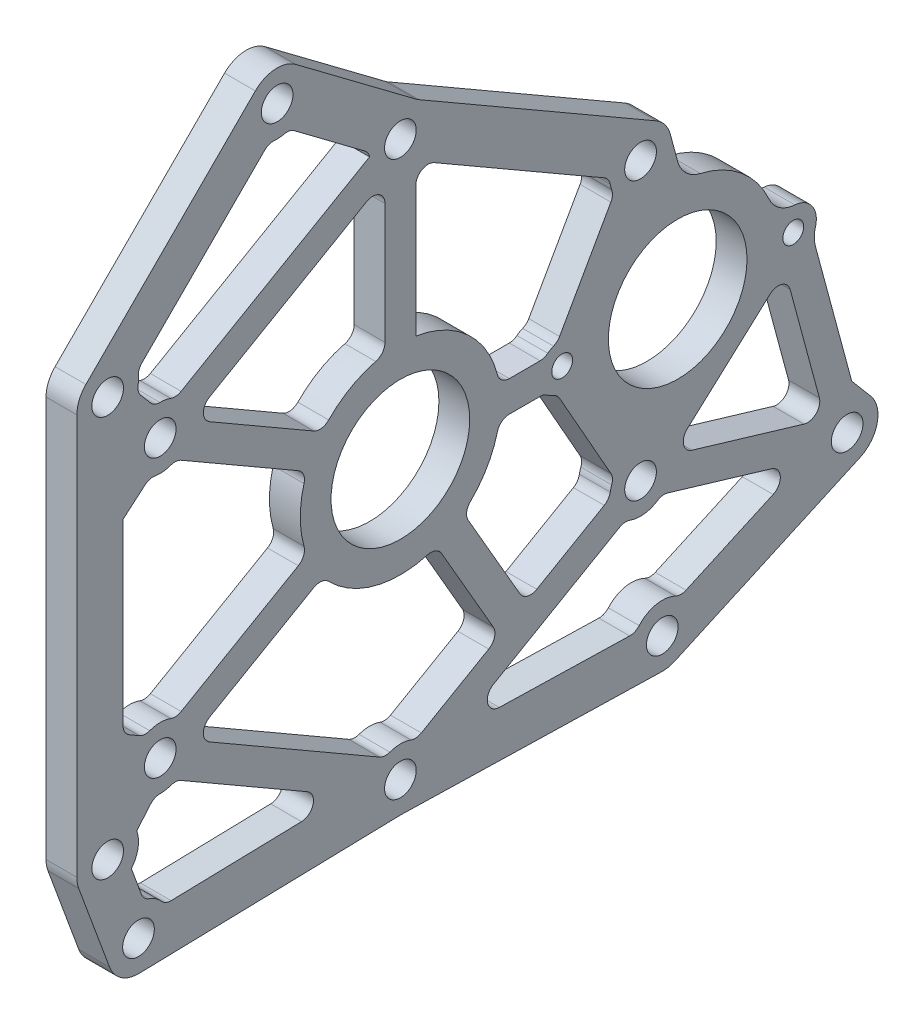
from build123d import *

# Parameters (mm, degrees)
SKETCH1_R           = 3.2639
SKETCH1_R_2         = 14.2875
SKETCH1_R_3         = 2.1463
BOSS_EXTRUDE1_DEPTH = 6.35
FILLET1_R           = 6.35
CUT_EXTRUDE1_DEPTH  = 129.616894934
FILLET2_R           = 2.54


with BuildPart() as part:
    # Sketch1 → Boss-Extrude1 (new body)
    with BuildSketch(Plane(origin=(0, 0, 0), x_dir=(0, 0, -1), z_dir=(1, 0, 0))):
        with BuildLine():
            Line((-66.675, 41.275), (-66.675, -41.275))
            ThreePointArc((-66.675, -41.275), (-66.576169332, -42.390966836), (-66.282753707, -43.472196115))
            Line((-66.282753707, -43.472196115), (-59.932753707, -60.690384235))
            ThreePointArc((-59.932753707, -60.690384235), (-57.541052248, -63.747307587), (-53.817026776, -64.841222814))
            Line((-53.817026776, -64.841222814), (-0.157973224, -63.505897139))
            ThreePointArc((-0.157973224, -63.505897139), (0, -63.503931831), (0.157973224, -63.505897139))
            Line((0.157973224, -63.505897139), (53.817026776, -64.841222814))
            ThreePointArc((53.817026776, -64.841222814), (55.235212183, -64.71688198), (56.59005615, -64.279722605))
            Line((56.59005615, -64.279722605), (94.69005615, -47.061534484))
            ThreePointArc((94.69005615, -47.061534484), (98.269102562, -42.673425347), (96.922502912, -37.173266767))
            Line((96.922502912, -37.173266767), (93.015657336, -32.556085631))
            Line((93.015657336, -32.556085631), (84.951172928, -2.602286403))
            ThreePointArc((84.951172928, -2.602286403), (83.92341694, 3.730198001), (77.522916667, 3.294035935))
            ThreePointArc((77.522916667, 3.294035935), (70.923774991, 15.368458893), (58.201383029, 20.610701103))
            Line((58.201383029, 20.610701103), (55.626980823, 30.218500936))
            ThreePointArc((55.626980823, 30.218500936), (54.531145537, 32.440635074), (52.668351826, 34.074261314))
            Line((52.668351826, 34.074261314), (3.835165361, 62.268114665))
            ThreePointArc((3.835165361, 62.268114665), (3.511379677, 62.468225223), (3.200165361, 62.687375979))
            Line((3.200165361, 62.687375979), (-21.59, 81.28))
            ThreePointArc((-21.59, 81.28), (-25.850145278, 82.534024726), (-29.890128061, 80.690128061))
            Line((-29.890128061, 80.690128061), (-64.815128061, 45.765128061))
            ThreePointArc((-64.815128061, 45.765128061), (-66.191635031, 43.705039796), (-66.675, 41.275))
        make_face()
        with Locations((-53.975, -58.493188121)):
            Circle(SKETCH1_R, mode=Mode.SUBTRACT)
        with Locations((-60.325, -41.275)):
            Circle(SKETCH1_R, mode=Mode.SUBTRACT)
        with Locations((-49.493351826, -28.575)):
            Circle(SKETCH1_R, mode=Mode.SUBTRACT)
        with Locations((0, -57.15)):
            Circle(SKETCH1_R, mode=Mode.SUBTRACT)
        Circle(SKETCH1_R_2, mode=Mode.SUBTRACT)
        with Locations((53.975, -58.493188121)):
            Circle(SKETCH1_R, mode=Mode.SUBTRACT)
        with Locations((49.493351826, -28.575)):
            Circle(SKETCH1_R, mode=Mode.SUBTRACT)
        with Locations((92.075, -41.275)):
            Circle(SKETCH1_R, mode=Mode.SUBTRACT)
        with Locations((33.3375, 0)):
            Circle(SKETCH1_R_3, mode=Mode.SUBTRACT)
        with Locations((57.15, 0)):
            Circle(SKETCH1_R_2, mode=Mode.SUBTRACT)
        with Locations((80.9625, 0)):
            Circle(SKETCH1_R_3, mode=Mode.SUBTRACT)
        with Locations((-49.493351826, 28.575)):
            Circle(SKETCH1_R, mode=Mode.SUBTRACT)
        with Locations((-60.325, 41.275)):
            Circle(SKETCH1_R, mode=Mode.SUBTRACT)
        with Locations((-25.4, 76.2)):
            Circle(SKETCH1_R, mode=Mode.SUBTRACT)
        with Locations((0, 57.15)):
            Circle(SKETCH1_R, mode=Mode.SUBTRACT)
        with Locations((49.493351826, 28.575)):
            Circle(SKETCH1_R, mode=Mode.SUBTRACT)
    extrude(amount=BOSS_EXTRUDE1_DEPTH)

    # Fillet1
    fillet1_edges = [part.edges().sort_by_distance(p)[0] for p in [
        (3.175, -2.602286403, -84.951172928),
        (3.175, 20.610701103, -58.201383029),
        (3.175, 3.294035935, -77.522916667),
    ]]
    fillet(fillet1_edges, radius=FILLET1_R)

    # Sketch2 → Cut-Extrude1 (cut, through all)
    with BuildSketch(Plane(origin=(6.35, 0, 0), x_dir=(0, 0, -1), z_dir=(1, 0, 0))):
        with BuildLine():
            Line((-27.043500936, 70.066371003), (-54.191371003, 42.918500936))
            ThreePointArc((-54.191371003, 42.918500936), (-53.979982179, 41.023506749), (-54.34069346, 39.151188513))
            Line((-54.34069346, 39.151188513), (-50.646230396, 34.819467231))
            ThreePointArc((-50.646230396, 34.819467231), (-48.415819119, 34.832908857), (-46.318351826, 34.074261314))
            Line((-46.318351826, 34.074261314), (-6.35, 57.15))
            ThreePointArc((-6.35, 57.15), (-6.338592015, 57.530461907), (-6.304409051, 57.909556788))
            Line((-6.304409051, 57.909556788), (-22.905590949, 70.360443212))
            ThreePointArc((-22.905590949, 70.360443212), (-24.949854722, 69.865975274), (-27.043500936, 70.066371003))
        make_face()
        with BuildLine():
            Line((-51.617163313, 22.59069346), (-57.15, 17.871816263))
            Line((-57.15, 17.871816263), (-57.15, -20.488257906))
            Line((-57.15, -20.488257906), (-52.668351826, -23.075738686))
            ThreePointArc((-52.668351826, -23.075738686), (-49.493351826, -22.225), (-46.318351826, -23.075738686))
            Line((-46.318351826, -23.075738686), (-19.247322647, -7.446272702))
            ThreePointArc((-19.247322647, -7.446272702), (-20.6375, 0), (-19.247322647, 7.446272702))
            Line((-19.247322647, 7.446272702), (-46.318351826, 23.075738686))
            ThreePointArc((-46.318351826, 23.075738686), (-48.914502502, 22.25143823), (-51.617163313, 22.59069346))
        make_face()
        with BuildLine():
            Line((-3.175, 51.650738686), (-43.143351826, 28.575))
            Line((-43.143351826, 28.575), (-16.072322647, 12.945534016))
            ThreePointArc((-16.072322647, 12.945534016), (-10.31875, 17.872599271), (-3.175, 20.391806719))
            Line((-3.175, 20.391806719), (-3.175, 51.650738686))
        make_face()
        with BuildLine():
            ThreePointArc((-54.34069346, -39.151188513), (-54.073566297, -42.389484927), (-55.443295494, -45.335968002))
            Line((-55.443295494, -45.335968002), (-52.898950799, -52.235024004))
            ThreePointArc((-52.898950799, -52.235024004), (-50.408947752, -53.239068655), (-48.556427304, -55.182361949))
            Line((-48.556427304, -55.182361949), (-11.361262376, -54.256746318))
            Line((-11.361262376, -54.256746318), (-46.318351826, -34.074261314))
            ThreePointArc((-46.318351826, -34.074261314), (-48.415819119, -34.832908857), (-50.646230396, -34.819467231))
            Line((-50.646230396, -34.819467231), (-54.34069346, -39.151188513))
        make_face()
        with BuildLine():
            Line((43.143351826, 28.575), (3.175, 51.650738686))
            Line((3.175, 51.650738686), (3.175, 20.391806719))
            ThreePointArc((3.175, 20.391806719), (14.592916197, 14.592916197), (20.391806719, 3.175))
            Line((20.391806719, 3.175), (29.787742086, 3.175))
            ThreePointArc((29.787742086, 3.175), (30.937670776, 4.113663324), (32.320735068, 4.652697639))
            Line((32.320735068, 4.652697639), (44.022955866, 25.350520502))
            ThreePointArc((44.022955866, 25.350520502), (43.367198288, 26.90384985), (43.143351826, 28.575))
        make_face()
        with BuildLine():
            Line((-16.072322647, -12.945534016), (-43.143351826, -28.575))
            Line((-43.143351826, -28.575), (-3.175, -51.650738686))
            ThreePointArc((-3.175, -51.650738686), (0, -50.8), (3.175, -51.650738686))
            Line((3.175, -51.650738686), (20.409545256, -41.700369343))
            Line((20.409545256, -41.700369343), (7.446272702, -19.247322647))
            ThreePointArc((7.446272702, -19.247322647), (-5.341378043, -19.93429424), (-16.072322647, -12.945534016))
        make_face()
        with BuildLine():
            ThreePointArc((32.320735068, -4.652697639), (30.937670776, -4.113663324), (29.787742086, -3.175))
            Line((29.787742086, -3.175), (20.391806719, -3.175))
            ThreePointArc((20.391806719, -3.175), (17.872599271, -10.31875), (12.945534016, -16.072322647))
            Line((12.945534016, -16.072322647), (25.90880657, -38.525369343))
            Line((25.90880657, -38.525369343), (43.143351826, -28.575))
            ThreePointArc((43.143351826, -28.575), (43.367198288, -26.90384985), (44.022955866, -25.350520502))
            Line((44.022955866, -25.350520502), (32.320735068, -4.652697639))
        make_face()
        with BuildLine():
            Line((11.361262376, -54.256746318), (48.556427304, -55.182361949))
            ThreePointArc((48.556427304, -55.182361949), (52.714787817, -52.269494262), (57.678757788, -53.335215821))
            Line((57.678757788, -53.335215821), (83.013909173, -41.885730188))
            Line((83.013909173, -41.885730188), (53.855774459, -33.189300464))
            ThreePointArc((53.855774459, -33.189300464), (50.23381253, -34.881680422), (46.318351826, -34.074261314))
            Line((46.318351826, -34.074261314), (11.361262376, -54.256746318))
        make_face()
        Polygon((55.795218544, -27.141329703), (87.52996775, -36.606236117), (79.248174638, -5.845290271), align=None)
    extrude(amount=-CUT_EXTRUDE1_DEPTH, mode=Mode.SUBTRACT)

    # Fillet2
    # the kernel refuses this fillet: 2.54 mm, written as the material it adds along each edge
    with BuildSketch(Plane(origin=(6.35, -36.606236117, -87.52996775), x_dir=(0, 0.2858094655797608, 0.9582864651997396), z_dir=(-1, 0, 0))) as fillet2_piece_1:
        with BuildLine():
            CenterArc((FILLET2_R * 1.7920692281, FILLET2_R), FILLET2_R, 148.324271538, 121.675728462)
            Line((FILLET2_R * 0.941035595636, FILLET2_R * 1.52511118481), (FILLET2_R * 0.924014922987, FILLET2_R * 1.53561340851))
            Line((FILLET2_R * 0.924014922987, FILLET2_R * 1.53561340851), (-FILLET2_R * 0.0170206726493, FILLET2_R * 0.0105022236963))
            Line((-FILLET2_R * 0.0170206726493, FILLET2_R * 0.0105022236963), (0, -FILLET2_R * 0.02))
            Line((0, -FILLET2_R * 0.02), (FILLET2_R * 1.7920692281, -FILLET2_R * 0.02))
            Line((FILLET2_R * 1.7920692281, -FILLET2_R * 0.02), (FILLET2_R * 1.7920692281, 0))
        make_face()
    extrude(amount=6.35)
    with BuildSketch(Plane(origin=(6.35, -5.845290271, -79.248174638), x_dir=(0, -0.9656157585206735, -0.2599734734478587), z_dir=(-1, 0, 0))) as fillet2_piece_2:
        with BuildLine():
            CenterArc((FILLET2_R * 1.63736229297, FILLET2_R), FILLET2_R, 152.828028306, 117.171971694)
            Line((FILLET2_R * 0.747722420101, FILLET2_R * 1.45666278215), (FILLET2_R * 0.729929622644, FILLET2_R * 1.4657960378))
            Line((FILLET2_R * 0.729929622644, FILLET2_R * 1.4657960378), (-FILLET2_R * 0.0327472458594, -FILLET2_R * 0.02))
            Line((-FILLET2_R * 0.0327472458594, -FILLET2_R * 0.02), (FILLET2_R * 1.63736229297, -FILLET2_R * 0.02))
            Line((FILLET2_R * 1.63736229297, -FILLET2_R * 0.02), (FILLET2_R * 1.63736229297, 0))
        make_face()
    extrude(amount=6.35)
    with BuildSketch(Plane(origin=(6.35, -27.141329703, -55.795218544), x_dir=(0, -0.28580946557976333, -0.9582864651997387), z_dir=(-1, 0, 0))) as fillet2_piece_3:
        with BuildLine():
            CenterArc((FILLET2_R * 1.77298804398, -FILLET2_R), FILLET2_R, 90, 121.152299844)
            Line((FILLET2_R * 0.917192809978, -FILLET2_R * 1.51731471799), (FILLET2_R * 0.900076905298, -FILLET2_R * 1.52766101235))
            Line((FILLET2_R * 0.900076905298, -FILLET2_R * 1.52766101235), (-FILLET2_R * 0.0171159046801, -FILLET2_R * 0.0103462943599))
            Line((-FILLET2_R * 0.0171159046801, -FILLET2_R * 0.0103462943599), (0, FILLET2_R * 0.02))
            Line((0, FILLET2_R * 0.02), (FILLET2_R * 1.77298804398, FILLET2_R * 0.02))
            Line((FILLET2_R * 1.77298804398, FILLET2_R * 0.02), (FILLET2_R * 1.77298804398, 0))
        make_face()
    extrude(amount=6.35)
    with BuildSketch(Plane(origin=(6.35, -55.182361949, -48.556427304), x_dir=(0, 0.024877673142268453, 0.9996905027952534), z_dir=(-1, 0, 0)), Plane(origin=(6.35, -33.189300464, -53.855774459), x_dir=(0, -0.2858094655798386, -0.9582864651997162), z_dir=(-1, 0, 0)), Plane(origin=(6.35, 25.350520502, -44.022955866), x_dir=(0, -0.8705006519204841, 0.49216726324087445), z_dir=(-1, 0, 0)), Plane(origin=(6.35, -28.575, -43.143351826), x_dir=(0, -0.49999999999997297, 0.8660254037844543), z_dir=(-1, 0, 0)), Plane(origin=(6.35, 34.819467231, 50.646230396), x_dir=(0, 0.7608547985275604, 0.6489221644832185), z_dir=(-1, 0, 0)), Plane(origin=(6.35, 42.918500936, 54.191371003), x_dir=(0, 0.7071067811865367, -0.7071067811865585), z_dir=(-1, 0, 0)), Plane(origin=(6.35, 70.360443212, 22.905590949), x_dir=(0, -0.5999999999999892, -0.8000000000000081), z_dir=(-1, 0, 0)), Plane(origin=(6.35, -23.075738686, 52.668351826), x_dir=(0, 0.499999999999939, 0.8660254037844738), z_dir=(-1, 0, 0)), Plane(origin=(6.35, 23.075738686, 46.318351826), x_dir=(0, -0.4999999999999284, -0.86602540378448), z_dir=(-1, 0, 0)), Plane(origin=(6.35, -51.650738686, 3.175), x_dir=(0, 0.49999999999993194, 0.8660254037844779), z_dir=(-1, 0, 0)), Plane(origin=(6.35, -52.235024004, 52.898950799), x_dir=(0, 0.9382289302447354, 0.3460151361599944), z_dir=(-1, 0, 0)), Plane(origin=(6.35, -34.074261314, 46.318351826), x_dir=(0, -0.49999999999993366, -0.8660254037844769), z_dir=(-1, 0, 0))) as fillet2_piece_4:
        with BuildLine():
            CenterArc((1.310355048, 2.54), FILLET2_R, 220.005200885, 49.994799115)
            Line((-0.635249627, 0.907142857), (-0.67416172, 0.874485714))
            ThreePointArc((-0.67416172, 0.874485714), (-0.339422746, 0.438306877), (-0.043994091, -0.0254))
            Line((-0.043994091, -0.0254), (0, -0.0508))
            Line((0, -0.0508), (1.310355048, -0.0508))
            Line((1.310355048, -0.0508), (1.310355048, 0))
        make_face()
    extrude(amount=6.35)
    with BuildSketch(Plane(origin=(6.35, -53.335215821, -57.678757788), x_dir=(0, 0.5102156062885996, 0.8600465307758394), z_dir=(-1, 0, 0)), Plane(origin=(6.35, -25.350520502, -44.022955866), x_dir=(0, -0.9024780320156424, 0.43073588395810847), z_dir=(-1, 0, 0)), Plane(origin=(6.35, 34.074261314, 46.318351826), x_dir=(0, 0.42257712736441655, 0.906326967174892), z_dir=(-1, 0, 0)), Plane(origin=(6.35, 39.151188513, 54.34069346), x_dir=(0, 0.9679856947383638, -0.2510053680340065), z_dir=(-1, 0, 0)), Plane(origin=(6.35, -23.075738686, 46.318351826), x_dir=(0, 0.42257712736440284, 0.9063269671748984), z_dir=(-1, 0, 0)), Plane(origin=(6.35, 22.59069346, 51.617163313), x_dir=(0, -0.25100536803401813, -0.9679856947383609), z_dir=(-1, 0, 0)), Plane(origin=(6.35, -51.650738686, -3.175), x_dir=(0, 0.42257712736440417, 0.9063269671748977), z_dir=(-1, 0, 0)), Plane(origin=(6.35, -34.819467231, 50.646230396), x_dir=(0, -0.09511235327319795, -0.995466544015837), z_dir=(-1, 0, 0))) as fillet2_piece_5:
        with BuildLine():
            CenterArc((1.328942573, 2.530324483), FILLET2_R, 215.002600442, 49.994799115)
            Line((-0.751637495, 1.073345904), (-0.793249096, 1.044206332))
            Line((-0.793249096, 1.044206332), (-0.041611601, -0.029139572))
            Line((-0.041611601, -0.029139572), (0.004429809, -0.05060649))
            ThreePointArc((0.004429809, -0.05060649), (0.553726072, -0.026611208), (1.103022336, -0.05060649))
            Line((1.103022336, -0.05060649), (1.107452144, 0))
        make_face()
    extrude(amount=6.35)
    with BuildSketch(Plane(origin=(6.35, -41.885730188, -83.013909173), x_dir=(0, -0.4118198661241969, 0.9112652730492085), z_dir=(-1, 0, 0))) as fillet2_piece_6:
        with BuildLine():
            CenterArc((FILLET2_R * 2.67986400985, FILLET2_R), FILLET2_R, 130.926447625, 139.073552375)
            Line((FILLET2_R * 2.02477436535, FILLET2_R * 1.75555116152), (FILLET2_R * 2.01167257246, FILLET2_R * 1.77066218475))
            Line((FILLET2_R * 2.01167257246, FILLET2_R * 1.77066218475), (-FILLET2_R * 0.01310179289, FILLET2_R * 0.0151110232304))
            Line((-FILLET2_R * 0.01310179289, FILLET2_R * 0.0151110232304), (0, -FILLET2_R * 0.02))
            Line((0, -FILLET2_R * 0.02), (FILLET2_R * 2.67986400985, -FILLET2_R * 0.02))
            Line((FILLET2_R * 2.67986400985, -FILLET2_R * 0.02), (FILLET2_R * 2.67986400985, 0))
        make_face()
    extrude(amount=6.35)
    with BuildSketch(Plane(origin=(6.35, -34.074261314, -46.318351826), x_dir=(0, -0.49999999999992195, 0.8660254037844837), z_dir=(-1, 0, 0)), Plane(origin=(6.35, 28.575, -43.143351826), x_dir=(0, 0.5000000000000767, 0.8660254037843944), z_dir=(-1, 0, 0)), Plane(origin=(6.35, 70.066371003, 27.043500936), x_dir=(0, -0.7071067811865624, 0.7071067811865327), z_dir=(-1, 0, 0)), Plane(origin=(6.35, -55.182361949, 48.556427304), x_dir=(0, 0.02487767314217471, -0.9996905027952556), z_dir=(-1, 0, 0))) as fillet2_piece_7:
        with BuildLine():
            CenterArc((1.310355048, -2.54), FILLET2_R, 90, 49.994799115)
            Line((-0.635249627, -0.907142857), (-0.67416172, -0.874485714))
            ThreePointArc((-0.67416172, -0.874485714), (-0.339422746, -0.438306877), (-0.043994091, 0.0254))
            Line((-0.043994091, 0.0254), (0, 0.0508))
            Line((0, 0.0508), (1.310355048, 0.0508))
            Line((1.310355048, 0.0508), (1.310355048, 0))
        make_face()
    extrude(amount=6.35)
    with BuildSketch(Plane(origin=(6.35, -54.256746318, -11.361262376), x_dir=(0, 0.49999999999999184, -0.8660254037844434), z_dir=(-1, 0, 0)), Plane(origin=(6.35, -54.256746318, 11.361262376), x_dir=(0, -0.024877673142222004, 0.9996905027952544), z_dir=(-1, 0, 0))) as fillet2_piece_8:
        with BuildLine():
            CenterArc((FILLET2_R * 3.554572812, FILLET2_R), FILLET2_R, 121.425532744, 148.574467256)
            Line((FILLET2_R * 3.03318286368, FILLET2_R * 1.85331853477), (FILLET2_R * 3.02275506471, FILLET2_R * 1.87038490547))
            Line((FILLET2_R * 3.02275506471, FILLET2_R * 1.87038490547), (-FILLET2_R * 0.0104277989665, FILLET2_R * 0.0170663706954))
            Line((-FILLET2_R * 0.0104277989665, FILLET2_R * 0.0170663706954), (0, -FILLET2_R * 0.02))
            Line((0, -FILLET2_R * 0.02), (FILLET2_R * 3.554572812, -FILLET2_R * 0.02))
            Line((FILLET2_R * 3.554572812, -FILLET2_R * 0.02), (FILLET2_R * 3.554572812, 0))
        make_face()
    extrude(amount=6.35)
    with BuildSketch(Plane(origin=(6.35, 51.650738686, -3.175), x_dir=(0, -0.499999999999991, -0.8660254037844438), z_dir=(-1, 0, 0)), Plane(origin=(6.35, 51.650738686, 3.175), x_dir=(0, -1, 0), z_dir=(-1, 0, 0))) as fillet2_piece_9:
        with BuildLine():
            CenterArc((FILLET2_R * 1.73205080757, FILLET2_R), FILLET2_R, 150, 120)
            Line((FILLET2_R * 0.866025403784, FILLET2_R * 1.5), (FILLET2_R * 0.848704895709, FILLET2_R * 1.51))
            Line((FILLET2_R * 0.848704895709, FILLET2_R * 1.51), (-FILLET2_R * 0.0173205080757, FILLET2_R * 0.01))
            Line((-FILLET2_R * 0.0173205080757, FILLET2_R * 0.01), (0, -FILLET2_R * 0.02))
            Line((0, -FILLET2_R * 0.02), (FILLET2_R * 1.73205080757, -FILLET2_R * 0.02))
            Line((FILLET2_R * 1.73205080757, -FILLET2_R * 0.02), (FILLET2_R * 1.73205080757, 0))
        make_face()
    extrude(amount=6.35)
    with BuildSketch(Plane(origin=(6.35, 4.652697639, -32.320735068), x_dir=(0, -0.29524206044005546, 0.955422485472846), z_dir=(-1, 0, 0)), Plane(origin=(6.35, -3.175, -29.787742086), x_dir=(0, -0.6863874195831854, -0.7272360760014154), z_dir=(-1, 0, 0))) as fillet2_piece_10:
        with BuildLine():
            CenterArc((1.01898763, 2.530924649), FILLET2_R, 226.655182243, 38.499950409)
            Line((-0.724436416, 0.683745016), (-0.759304897, 0.646801423))
            Line((-0.759304897, 0.646801423), (-0.034868481, -0.036943593))
            Line((-0.034868481, -0.036943593), (0.004290474, -0.050618493))
            ThreePointArc((0.004290474, -0.050618493), (0.402231959, -0.033783716), (0.800173444, -0.050618493))
            Line((0.800173444, -0.050618493), (0.804463918, 0))
        make_face()
    extrude(amount=6.35)
    with BuildSketch(Plane(origin=(6.35, 3.175, -29.787742086), x_dir=(0, 0, 1), z_dir=(-1, 0, 0)), Plane(origin=(6.35, -4.652697639, -32.320735068), x_dir=(0, -0.8705006519204627, -0.4921672632409122), z_dir=(-1, 0, 0))) as fillet2_piece_11:
        with BuildLine():
            CenterArc((0.996150273, 2.54), FILLET2_R, 231.500049591, 38.499950409)
            Line((-0.585035183, 0.552173913), (-0.616658892, 0.512417391))
            ThreePointArc((-0.616658892, 0.512417391), (-0.315706309, 0.251518219), (-0.037864084, -0.033866667))
            Line((-0.037864084, -0.033866667), (0, -0.0508))
            Line((0, -0.0508), (0.996150273, -0.0508))
            Line((0.996150273, -0.0508), (0.996150273, 0))
        make_face()
    extrude(amount=6.35)
    with BuildSketch(Plane(origin=(6.35, 3.175, -20.391806719), x_dir=(0, 0.9797069356812805, 0.20043532667171082), z_dir=(-1, 0, 0))) as fillet2_piece_12:
        with BuildLine():
            CenterArc((2.073543246, 2.537154047), FILLET2_R, 191.562416899, 75.7250493)
            Line((-0.41491237, 2.028048318), (-0.464681483, 2.017866203))
            Line((-0.464681483, 2.017866203), (-0.049769112, -0.010182115))
            Line((-0.049769112, -0.010182115), (0.002404108, -0.050743081))
            ThreePointArc((0.002404108, -0.050743081), (0.97666892, -0.027676635), (1.950933732, -0.050743081))
            Line((1.950933732, -0.050743081), (1.953337841, 0))
        make_face()
    extrude(amount=6.35)
    with BuildSketch(Plane(origin=(6.35, -3.175, -20.391806719), x_dir=(0, 0, -1), z_dir=(-1, 0, 0)), Plane(origin=(6.35, 12.945534016, 16.072322647), x_dir=(0, 0.5000000000000324, 0.86602540378442), z_dir=(-1, 0, 0)), Plane(origin=(6.35, -7.446272702, 19.247322647), x_dir=(0, -0.4999999999999258, 0.8660254037844815), z_dir=(-1, 0, 0)), Plane(origin=(6.35, -19.247322647, -7.446272702), x_dir=(0, -0.8660254037844852, -0.49999999999991923), z_dir=(-1, 0, 0))) as fillet2_piece_13:
        with BuildLine():
            CenterArc((2.070056099, 2.54), FILLET2_R, 194.2749507, 75.7250493)
            Line((-0.391517908, 1.91369863), (-0.440749388, 1.901172603))
            ThreePointArc((-0.440749388, 1.901172603), (-0.222873946, 0.95130194), (-0.050195217, -0.007815385))
            Line((-0.050195217, -0.007815385), (0, -0.0508))
            Line((0, -0.0508), (2.070056099, -0.0508))
            Line((2.070056099, -0.0508), (2.070056099, 0))
        make_face()
    extrude(amount=6.35)
    with BuildSketch(Plane(origin=(6.35, -38.525369343, -25.90880657), x_dir=(0, 0.8660254037844444, 0.49999999999998995), z_dir=(-1, 0, 0)), Plane(origin=(6.35, -41.700369343, -20.409545256), x_dir=(0, -0.49999999999998995, 0.8660254037844444), z_dir=(-1, 0, 0))) as fillet2_piece_14:
        with BuildLine():
            CenterArc((FILLET2_R, FILLET2_R), FILLET2_R, 180, 90)
            Line((0, FILLET2_R), (-FILLET2_R * 0.02, FILLET2_R))
            Line((-FILLET2_R * 0.02, FILLET2_R), (-FILLET2_R * 0.02, -FILLET2_R * 0.02))
            Line((-FILLET2_R * 0.02, -FILLET2_R * 0.02), (FILLET2_R, -FILLET2_R * 0.02))
            Line((FILLET2_R, -FILLET2_R * 0.02), (FILLET2_R, 0))
        make_face()
    extrude(amount=6.35)
    with BuildSketch(Plane(origin=(6.35, -16.072322647, -12.945534016), x_dir=(0, -0.8660254037844234, -0.5000000000000263), z_dir=(-1, 0, 0)), Plane(origin=(6.35, 20.391806719, 3.175), x_dir=(0, 1, 0), z_dir=(-1, 0, 0)), Plane(origin=(6.35, 7.446272702, 19.247322647), x_dir=(0, 0.49999999999992695, 0.8660254037844808), z_dir=(-1, 0, 0)), Plane(origin=(6.35, -12.945534016, 16.072322647), x_dir=(0, -0.5000000000000469, 0.8660254037844117), z_dir=(-1, 0, 0))) as fillet2_piece_15:
        with BuildLine():
            CenterArc((2.070056099, -2.54), FILLET2_R, 90, 75.7250493)
            Line((-0.391517908, -1.91369863), (-0.440749388, -1.901172603))
            ThreePointArc((-0.440749388, -1.901172603), (-0.222873946, -0.95130194), (-0.050195217, 0.007815385))
            Line((-0.050195217, 0.007815385), (0, 0.0508))
            Line((0, 0.0508), (2.070056099, 0.0508))
            Line((2.070056099, 0.0508), (2.070056099, 0))
        make_face()
    extrude(amount=6.35)
    with BuildSketch(Plane(origin=(6.35, 57.909556788, 6.304409051), x_dir=(0, -0.9982034669914647, 0.05991526087917752), z_dir=(-1, 0, 0))) as fillet2_piece_16:
        with BuildLine():
            CenterArc((1.424977359, 2.451659211), FILLET2_R, 213.434948823, 41.409622109)
            Line((-0.694682944, 1.052144938), (-0.73707615, 1.024154652))
            Line((-0.73707615, 1.024154652), (-0.042393206, -0.027990285))
            Line((-0.042393206, -0.027990285), (0.003043695, -0.050708736))
            ThreePointArc((0.003043695, -0.050708736), (0.380461907, -0.039392015), (0.747642742, -0.049033184))
            Line((0.747642742, -0.049033184), (0.760923813, 0))
        make_face()
    extrude(amount=6.35)
    with BuildSketch(Plane(origin=(6.35, 28.575, 43.143351826), x_dir=(0, 0.4999999999999893, -0.8660254037844447), z_dir=(-1, 0, 0)), Plane(origin=(6.35, -28.575, 43.143351826), x_dir=(0, 0.5000000000000003, -0.8660254037844385), z_dir=(-1, 0, 0))) as fillet2_piece_17:
        with BuildLine():
            CenterArc((FILLET2_R * 1.73205080757, FILLET2_R), FILLET2_R, 150, 120)
            Line((FILLET2_R * 0.866025403784, FILLET2_R * 1.5), (FILLET2_R * 0.848704895709, FILLET2_R * 1.51))
            Line((FILLET2_R * 0.848704895709, FILLET2_R * 1.51), (-FILLET2_R * 0.0346410161514, -FILLET2_R * 0.02))
            Line((-FILLET2_R * 0.0346410161514, -FILLET2_R * 0.02), (FILLET2_R * 1.73205080757, -FILLET2_R * 0.02))
            Line((FILLET2_R * 1.73205080757, -FILLET2_R * 0.02), (FILLET2_R * 1.73205080757, 0))
        make_face()
    extrude(amount=6.35)
    with BuildSketch(Plane(origin=(6.35, -20.488257906, 57.15), x_dir=(0, 1, 0), z_dir=(-1, 0, 0))) as fillet2_piece_18:
        with BuildLine():
            CenterArc((FILLET2_R * 0.57735026919, FILLET2_R), FILLET2_R, 210, 60)
            Line((-FILLET2_R * 0.288675134595, FILLET2_R * 0.5), (-FILLET2_R * 0.305995642671, FILLET2_R * 0.49))
            Line((-FILLET2_R * 0.305995642671, FILLET2_R * 0.49), (-FILLET2_R * 0.0115470053838, -FILLET2_R * 0.02))
            Line((-FILLET2_R * 0.0115470053838, -FILLET2_R * 0.02), (FILLET2_R * 0.57735026919, -FILLET2_R * 0.02))
            Line((FILLET2_R * 0.57735026919, -FILLET2_R * 0.02), (FILLET2_R * 0.57735026919, 0))
        make_face()
    extrude(amount=6.35)


solid = part.part
